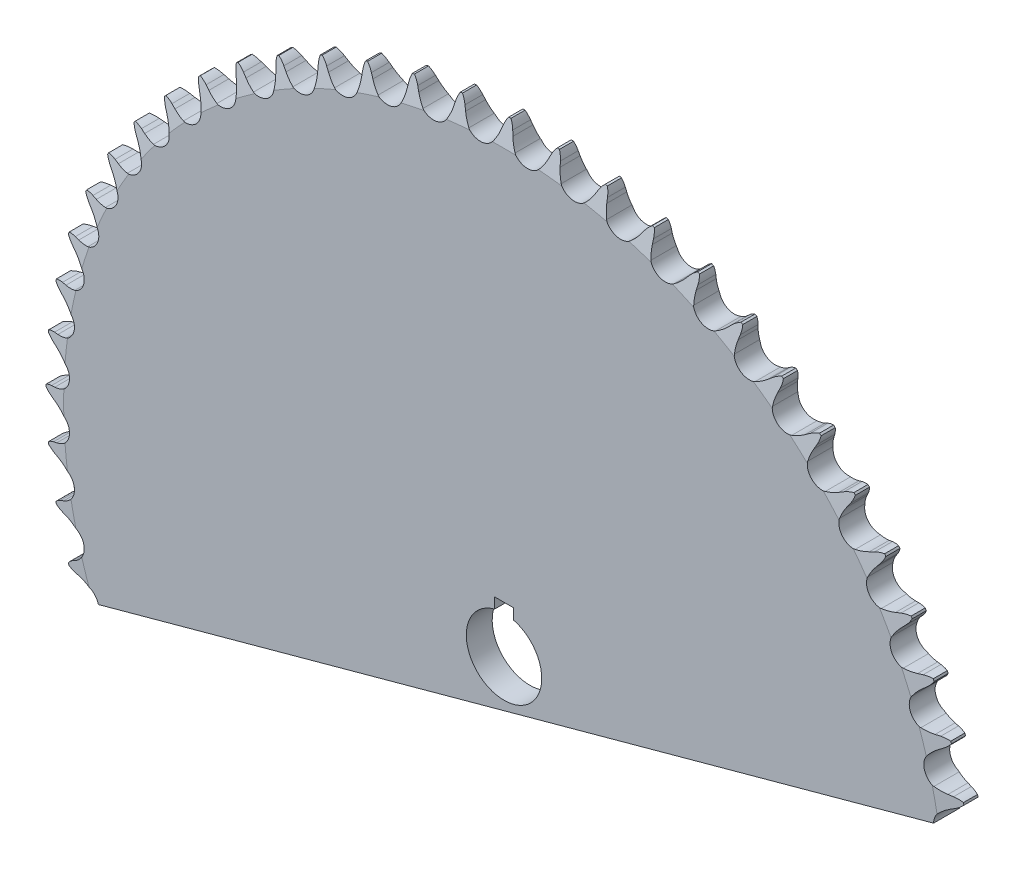
from build123d import *

# Parameters (mm, degrees)
CUT_EXTRUDE1_DEPTH      = 221.970001501
CIRPATTERN1_COUNT       = 60
BOSS_EXTRUDE1_START     = 4.3561
SKETCH2_R               = 47.625
BOSS_EXTRUDE1_DEPTH     = 23.0378
CUT_EXTRUDE2_DEPTH      = 223.618938493
CUT_EXTRUDE2_DEPTH_BACK = 223.618938493
SKETCH3_OUTSIDE_W       = 403.036
SKETCH3_OUTSIDE_H       = 403.036
SKETCH3_OUTSIDE_R       = 156.21
SKETCH3_OUTSIDE_R_2     = 12.7
SKETCH4_W               = 5.445125
SKETCH4_H               = 13.081
SKETCH5_W               = 6.35
SKETCH5_H               = 6.35
CUT_EXTRUDE3_DEPTH      = 224.184208139
SKETCH6_R               = 3.086805556
CUT_EXTRUDE4_DEPTH      = 47.625
CUT_SWEEP1_PITCH        = 1.411111111
CUT_EXTRUDE5_START      = -31.75
SKETCH9_R               = 4.121507259
CUT_EXTRUDE5_DEPTH      = 291.014781106
CIRPATTERN2_COUNT       = 2
CIRPATTERN2_ANGLE       = 90
CUT_SWEEP2_PITCH        = 1.411111111
CUT_EXTRUDE6_DEPTH      = 2.48046875
CIRPATTERN3_COUNT       = 2
CIRPATTERN3_ANGLE       = 90
CUT_EXTRUDE9_DEPTH      = 224.184208153
SKETCH16_W              = 140.243710457
SKETCH16_H              = 76.207927326
CUT_EXTRUDE10_DEPTH     = 236.826728787


with BuildPart() as part:
    # Sketch1 → Revolve1 (revolve)
    with BuildSketch(Plane(origin=(0, 0, 0), x_dir=(0, 0, -1), z_dir=(1, 0, 0)), mode=Mode.PRIVATE) as revolve1_sk:
        Polygon((4.3561, 0), (-4.3561, 0), (-4.3561, 148.281522459), (-2.371725, 156.219022459), (2.371725, 156.219022459), (4.3561, 148.281522459), align=None)
    revolve(revolve1_sk.sketch.rotate(Axis((0, 0, -4.3561), (0, 0, 1)), 90), axis=Axis((0, 0, -4.3561), (0, 0, 1)))

    # Sketch0 → Cut-Extrude1 (cut, symmetric)
    with BuildSketch(Plane.XY):
        with BuildLine():
            Line((14.499260159, -153.023713026), (13.931754529, -151.614368213))
            ThreePointArc((13.931754529, -151.614368213), (13.05988582, -149.842497031), (11.934750253, -148.219613027))
            ThreePointArc((11.934750253, -148.219613027), (7.668310009, -146.320071447), (3.623797934, -148.655171582))
            ThreePointArc((3.623797934, -148.655171582), (2.674463548, -150.386773949), (1.992581998, -152.240073732))
            Line((1.992581998, -152.240073732), (1.575501871, -153.701018498))
            ThreePointArc((1.575501871, -153.701018498), (-1.498620996, -158.084120103), (-6.625573679, -159.625602268))
            ThreePointArc((-6.625573679, -159.625602268), (8.361351827, -159.544097107), (23.274696996, -158.058595482))
            ThreePointArc((23.274696996, -158.058595482), (18.014701535, -157.061470202), (14.499260159, -153.023713026))
        make_face()
    cut_extrude1 = extrude(amount=CUT_EXTRUDE1_DEPTH, both=True, mode=Mode.SUBTRACT)

    # CirPattern1: Cut-Extrude1 ×60 about axis
    cirpattern1_axis = Axis((0, 0, 0), (0, 0, 1))
    for i in range(1, CIRPATTERN1_COUNT):
        add(cut_extrude1.rotate(cirpattern1_axis, i * 360 / CIRPATTERN1_COUNT), mode=Mode.SUBTRACT)

    # Sketch2 → Boss-Extrude1 (add)
    with BuildSketch(Plane.XY.offset(BOSS_EXTRUDE1_START)):
        Circle(SKETCH2_R)
    extrude(amount=BOSS_EXTRUDE1_DEPTH)

    # Sketch3 outside → Cut-Extrude2 (cut, two sides: drawn at the far end of the back side and taken through both)
    # profile 1 of 2: a face of its own
    with BuildSketch(Plane.XY.offset(-CUT_EXTRUDE2_DEPTH_BACK)):
        Rectangle(SKETCH3_OUTSIDE_W, SKETCH3_OUTSIDE_H)
        Circle(SKETCH3_OUTSIDE_R, mode=Mode.SUBTRACT)
    # profile 2 of 2: a face of its own
    with BuildSketch(Plane.XY.offset(-CUT_EXTRUDE2_DEPTH_BACK)):
        Circle(SKETCH3_OUTSIDE_R_2)
    extrude(amount=CUT_EXTRUDE2_DEPTH + CUT_EXTRUDE2_DEPTH_BACK, mode=Mode.SUBTRACT)

    # Sketch4 → Cut-Revolve1 (revolve, cut)
    with BuildSketch(Plane(origin=(0, 0, 0), x_dir=(0, 0, -1), z_dir=(1, 0, 0))):
        Polygon((-27.3939, 47.625), (-27.3939, 46.99), (-26.7589, 47.625), align=None)
        with Locations((-7.0786625, 149.678522459)):
            Rectangle(SKETCH4_W, SKETCH4_H)
    revolve(axis=Axis((0, 0, -4.3561), (0, 0, 1)), mode=Mode.SUBTRACT)

    # Sketch5 → Cut-Extrude3 (cut, through all)
    with BuildSketch(Plane(origin=(0, 0, -4.3561), x_dir=(-1, 0, 0), z_dir=(0, 0, -1))):
        with Locations((0, 12.7)):
            Rectangle(SKETCH5_W, SKETCH5_H)
    extrude(amount=-CUT_EXTRUDE3_DEPTH, mode=Mode.SUBTRACT)

    # Sketch6 → Cut-Extrude4 (cut)
    with BuildSketch(Plane(origin=(0, 47.625, 0), x_dir=(-1, 0, 0), z_dir=(0, 1, 0))):
        with Locations(Location((0, 21.440775, 0), (0, 0, 90))):
            Circle(SKETCH6_R)
    cut_extrude4 = extrude(amount=-CUT_EXTRUDE4_DEPTH, mode=Mode.SUBTRACT)

    # Cut-Sweep1: arcs per turn and ends read off the stored shape
    # Cut-Sweep1: the profile of Sketch8 screwed along a right-hand helix through 35.75 turns, 8 arcs to a turn; built about Z, then put on its axis
    cut_sweep1_z = Axis((0, 0, 0), (0, 0, 1))
    cut_sweep1_corners = [(3.96875, 0, -2.028472222), (3.96875, 0, -2.204861111), (2.975827818, 0, -2.778125), (2.975827818, 0, -1.455208333)]
    with BuildLine(mode=Mode.PRIVATE) as cut_sweep1_profile:
        Line(cut_sweep1_corners[0], cut_sweep1_corners[1])
        Line(cut_sweep1_corners[1], cut_sweep1_corners[2])
        Line(cut_sweep1_corners[2], cut_sweep1_corners[3])
        Line(cut_sweep1_corners[3], cut_sweep1_corners[0])
    cut_sweep1_cap = Face(cut_sweep1_profile.wire())
    cut_sweep1_turn_angles = [0, 22.5, 45, 67.5, 90, 112.5, 135, 157.5, 180, 202.5, 225, 247.5, 270, 292.5, 315, 337.5, 360]
    cut_sweep1_turn_weights = [1, 0.9238795325112867, 1, 0.9238795325112867, 1, 0.9238795325112867, 1, 0.9238795325112867, 1, 0.9238795325112867, 1, 0.9238795325112867, 1, 0.9238795325112867, 1, 0.9238795325112867, 1]
    cut_sweep1_turn_rails = [Edge.make_bspline([Vector(p[0], p[1], 0).rotate(cut_sweep1_z, cut_sweep1_turn_angles[k]) / cut_sweep1_turn_weights[k] + Vector(0, 0, p[2] + CUT_SWEEP1_PITCH * cut_sweep1_turn_angles[k] / 360) for k in range(17)], [0, 0, 0, 1, 1, 2, 2, 3, 3, 4, 4, 5, 5, 6, 6, 7, 7, 8, 8, 8], 2, cut_sweep1_turn_weights) for p in cut_sweep1_corners]
    cut_sweep1_turn_sides = [Face.make_surface_from_curves(cut_sweep1_turn_rails[p[0]], cut_sweep1_turn_rails[p[1]]) for p in [(0, 1), (1, 2), (2, 3), (3, 0)]]
    cut_sweep1_last_angles = [12600, 12622.5, 12645, 12667.5, 12690, 12712.5, 12735, 12757.5, 12780, 12802.5, 12825, 12847.5, 12870]
    cut_sweep1_last_weights = [1, 0.9238795325112867, 1, 0.9238795325112867, 1, 0.9238795325112867, 1, 0.9238795325112867, 1, 0.9238795325112867, 1, 0.9238795325112867, 1]
    cut_sweep1_last_rails = [Edge.make_bspline([Vector(p[0], p[1], 0).rotate(cut_sweep1_z, cut_sweep1_last_angles[k]) / cut_sweep1_last_weights[k] + Vector(0, 0, p[2] + CUT_SWEEP1_PITCH * cut_sweep1_last_angles[k] / 360) for k in range(13)], [0, 0, 0, 1, 1, 2, 2, 3, 3, 4, 4, 5, 5, 6, 6, 6], 2, cut_sweep1_last_weights) for p in cut_sweep1_corners]
    cut_sweep1_last_sides = [Face.make_surface_from_curves(cut_sweep1_last_rails[p[0]], cut_sweep1_last_rails[p[1]]) for p in [(0, 1), (1, 2), (2, 3), (3, 0)]]
    cut_sweep1 = Plane(origin=(0, 47.625, 21.440775), x_dir=(0, 0, 1), z_dir=(0, -1, 0)) * Solid(Shell([*[p.moved(Location((0, 0, CUT_SWEEP1_PITCH * i))) for i in range(35) for p in cut_sweep1_turn_sides], *cut_sweep1_last_sides, cut_sweep1_cap, cut_sweep1_cap.rotate(cut_sweep1_z, 12870).moved(Location((0, 0, CUT_SWEEP1_PITCH * 12870 / 360)))]))
    add(cut_sweep1, mode=Mode.SUBTRACT)

    # Sketch9 → Cut-Extrude5 (cut)
    with BuildSketch(Plane(origin=(0, 47.625, 0), x_dir=(-1, 0, 0), z_dir=(0, 1, 0)).offset(CUT_EXTRUDE5_START)):
        with Locations((0, 21.440775)):
            Circle(SKETCH9_R)
    cut_extrude5 = extrude(amount=CUT_EXTRUDE5_DEPTH, mode=Mode.SUBTRACT)

    # CirPattern2: Cut-Extrude4, Cut-Sweep1, Cut-Extrude5 ×2 about axis
    cirpattern2_axis = Axis((0, 0, 27.3939), (0, 0, -1))
    add([cut_extrude4.rotate(cirpattern2_axis, i * CIRPATTERN2_ANGLE / (CIRPATTERN2_COUNT - 1)) for i in range(1, CIRPATTERN2_COUNT)], mode=Mode.SUBTRACT)
    add([cut_sweep1.rotate(cirpattern2_axis, i * CIRPATTERN2_ANGLE / (CIRPATTERN2_COUNT - 1)) for i in range(1, CIRPATTERN2_COUNT)], mode=Mode.SUBTRACT)
    add([cut_extrude5.rotate(cirpattern2_axis, i * CIRPATTERN2_ANGLE / (CIRPATTERN2_COUNT - 1)) for i in range(1, CIRPATTERN2_COUNT)], mode=Mode.SUBTRACT)


with BuildPart() as body_2:
    # Sketch10 → Revolve2 (revolve)
    with BuildSketch(Plane(origin=(0, 0, 0), x_dir=(0, 0, -1), z_dir=(1, 0, 0))):
        Polygon((-21.440775, 47.625), (-21.440775, 39.6875), (-24.340224189, 39.6875), (-25.409525, 40.756800811), (-25.409525, 46.555699189), (-24.340224189, 47.625), align=None)
    revolve(axis=Axis((0, 47.625, 21.440775), (0, -1, 0)))

    # Cut-Sweep2: arcs per turn and ends read off the stored shape
    # Cut-Sweep2: the profile of Sketch12 screwed along a right-hand helix through 6.625 turns, 8 arcs to a turn; built about Z, then put on its axis
    cut_sweep2_z = Axis((0, 0, 0), (0, 0, 1))
    cut_sweep2_corners = [(4.045128629, 0, -0.661458333), (4.045128629, 0, 0.661458333), (3.052206448, 0, 0.088194444), (3.052206448, 0, -0.088194444)]
    with BuildLine(mode=Mode.PRIVATE) as cut_sweep2_profile:
        Line(cut_sweep2_corners[0], cut_sweep2_corners[1])
        Line(cut_sweep2_corners[1], cut_sweep2_corners[2])
        Line(cut_sweep2_corners[2], cut_sweep2_corners[3])
        Line(cut_sweep2_corners[3], cut_sweep2_corners[0])
    cut_sweep2_cap = Face(cut_sweep2_profile.wire())
    cut_sweep2_turn_angles = [0, 22.5, 45, 67.5, 90, 112.5, 135, 157.5, 180, 202.5, 225, 247.5, 270, 292.5, 315, 337.5, 360]
    cut_sweep2_turn_weights = [1, 0.9238795325112867, 1, 0.9238795325112867, 1, 0.9238795325112867, 1, 0.9238795325112867, 1, 0.9238795325112867, 1, 0.9238795325112867, 1, 0.9238795325112867, 1, 0.9238795325112867, 1]
    cut_sweep2_turn_rails = [Edge.make_bspline([Vector(p[0], p[1], 0).rotate(cut_sweep2_z, cut_sweep2_turn_angles[k]) / cut_sweep2_turn_weights[k] + Vector(0, 0, p[2] + CUT_SWEEP2_PITCH * cut_sweep2_turn_angles[k] / 360) for k in range(17)], [0, 0, 0, 1, 1, 2, 2, 3, 3, 4, 4, 5, 5, 6, 6, 7, 7, 8, 8, 8], 2, cut_sweep2_turn_weights) for p in cut_sweep2_corners]
    cut_sweep2_turn_sides = [Face.make_surface_from_curves(cut_sweep2_turn_rails[p[0]], cut_sweep2_turn_rails[p[1]]) for p in [(0, 1), (1, 2), (2, 3), (3, 0)]]
    cut_sweep2_last_angles = [2160, 2182.5, 2205, 2227.5, 2250, 2272.5, 2295, 2317.5, 2340, 2362.5, 2385]
    cut_sweep2_last_weights = [1, 0.9238795325112867, 1, 0.9238795325112867, 1, 0.9238795325112867, 1, 0.9238795325112867, 1, 0.923879532511264, 1]
    cut_sweep2_last_rails = [Edge.make_bspline([Vector(p[0], p[1], 0).rotate(cut_sweep2_z, cut_sweep2_last_angles[k]) / cut_sweep2_last_weights[k] + Vector(0, 0, p[2] + CUT_SWEEP2_PITCH * cut_sweep2_last_angles[k] / 360) for k in range(11)], [0, 0, 0, 1, 1, 2, 2, 3, 3, 4, 4, 5, 5, 5], 2, cut_sweep2_last_weights) for p in cut_sweep2_corners]
    cut_sweep2_last_sides = [Face.make_surface_from_curves(cut_sweep2_last_rails[p[0]], cut_sweep2_last_rails[p[1]]) for p in [(0, 1), (1, 2), (2, 3), (3, 0)]]
    cut_sweep2 = Plane(origin=(0, 47.625, 21.440775), x_dir=(0, 0, 1), z_dir=(0, -1, 0)) * Solid(Shell([*[p.moved(Location((0, 0, CUT_SWEEP2_PITCH * i))) for i in range(6) for p in cut_sweep2_turn_sides], *cut_sweep2_last_sides, cut_sweep2_cap, cut_sweep2_cap.rotate(cut_sweep2_z, 2385).moved(Location((0, 0, CUT_SWEEP2_PITCH * 2385 / 360)))]))
    add(cut_sweep2, mode=Mode.SUBTRACT)

    # Sketch13 → Cut-Extrude6 (cut)
    with BuildSketch(Plane(origin=(0, 47.625, 0), x_dir=(1, 0, 0), z_dir=(0, 1, 0))):
        Polygon((0, -19.149416119), (-1.984375, -20.29509556), (-1.984375, -22.58645444), (0, -23.732133881), (1.984375, -22.58645444), (1.984375, -20.29509556), align=None)
    extrude(amount=-CUT_EXTRUDE6_DEPTH, mode=Mode.SUBTRACT)

    # Cut-Extrude7 cone 1 section (through the dimple's axis) → Cut-Extrude7 (revolve, cut)
    with BuildSketch(Plane(origin=(0, 47.625, 21.440775), x_dir=(0, 0, 1), z_dir=(1, 0, 0))):
        Polygon((0, 0), (2.291358881, 0), (0, 1.322916667), align=None)
    revolve(axis=Axis((0, 47.625, 21.440775), (0, -1, 0)), mode=Mode.SUBTRACT)


with BuildPart() as cirpattern3_1:
    # CirPattern3: pattern copy
    add(body_2.part.rotate(Axis((0, 0, 27.3939), (0, 0, -1)), 1 * CIRPATTERN3_ANGLE / (CIRPATTERN3_COUNT - 1)))


with BuildPart() as cut_extrude9_tool:
    # Sketch15 → Cut-Extrude9 (new, through all)
    with BuildSketch(Plane(origin=(0, 0, -4.3561), x_dir=(-1, 0, 0), z_dir=(0, 0, -1))):
        Polygon((163.051806786, -60.311528675), (-174.645000465, 31.980373834), (-238.336343284, -201.066757439), (46.609939296, -278.942040734), align=None)
    extrude(amount=-CUT_EXTRUDE9_DEPTH)


with BuildPart() as part_1:
    add(part.part)

    # Cut-Extrude9: cut by cut_extrude9_tool
    add(cut_extrude9_tool.part, mode=Mode.SUBTRACT)


with BuildPart() as cirpattern3_1_1:
    add(cirpattern3_1.part)

    # Cut-Extrude9: cut by cut_extrude9_tool
    add(cut_extrude9_tool.part, mode=Mode.SUBTRACT)


with BuildPart() as cut_extrude10_tool:
    # Sketch16 → Cut-Extrude10 (new, through all)
    with BuildSketch(Plane(origin=(4.005226465, -14.655155576, 0), x_dir=(0.9646239040003087, 0.26362989934983344, 0), z_dir=(0.26362989934983344, -0.9646239040003087, 0))):
        with Locations((-7.562706664, 42.460063663)):
            Rectangle(SKETCH16_W, SKETCH16_H)
    extrude(amount=-CUT_EXTRUDE10_DEPTH)


with BuildPart() as part_2:
    add(part_1.part)

    # Cut-Extrude10: cut by cut_extrude10_tool
    add(cut_extrude10_tool.part, mode=Mode.SUBTRACT)


with BuildPart() as body_2_1:
    add(body_2.part)

    # Cut-Extrude10: cut by cut_extrude10_tool
    add(cut_extrude10_tool.part, mode=Mode.SUBTRACT)


with BuildPart() as cirpattern3_1_2:
    add(cirpattern3_1_1.part)

    # Cut-Extrude10: cut by cut_extrude10_tool
    add(cut_extrude10_tool.part, mode=Mode.SUBTRACT)


solid = part_2.part
